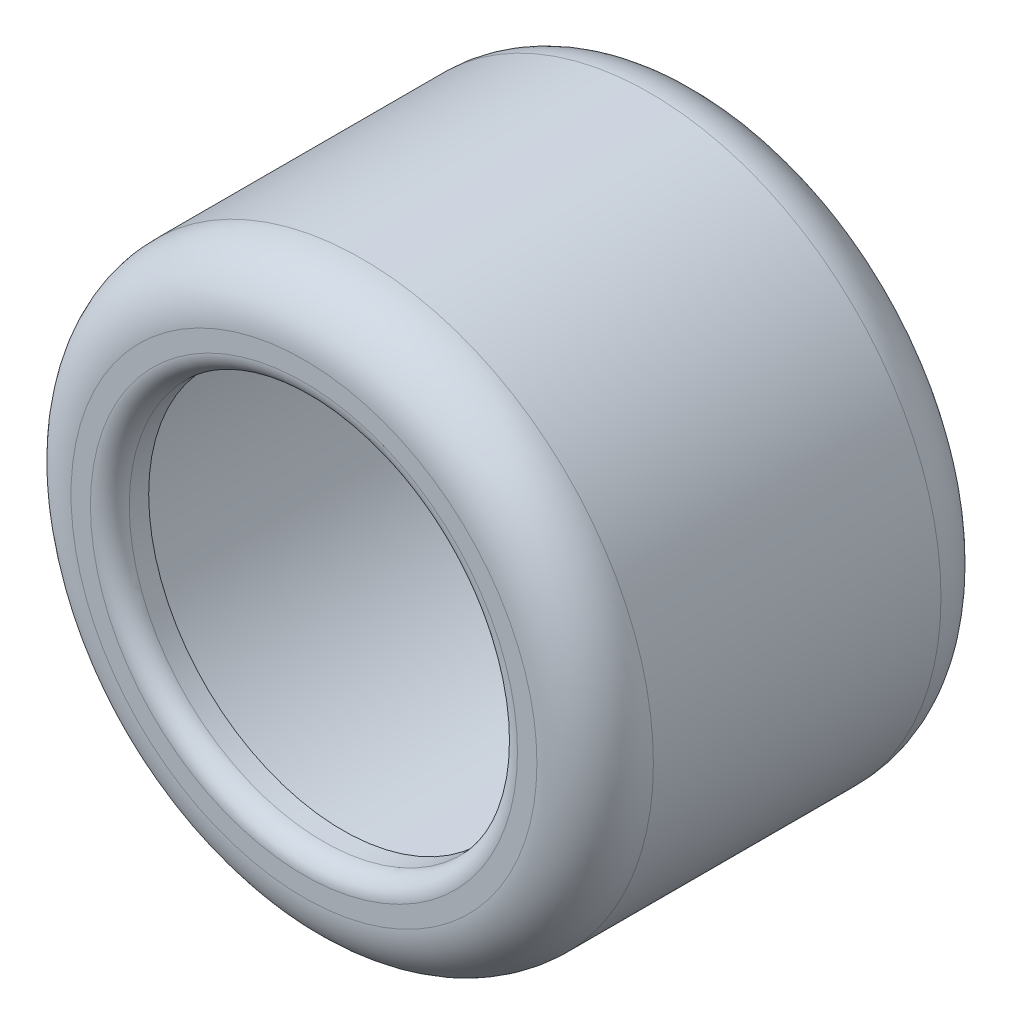
from build123d import *

# Parameters (mm, degrees)
CROQUIS1_R            = 15
CROQUIS1_R_2          = 10
EXTRUIR_L_MINA1_DEPTH = 20.815243217
REDONDEO1_R           = 3
REDONDEO2_R           = 1
ESCALA4_SCALE         = 4
ESCALA6_SCALE         = 2


# Read off the part's stored shape, not the designer's step: Vaciado1
with BuildPart() as part:
    # Croquis1 → Extruir-Lámina1 (new body)
    with BuildSketch(Plane.XY):
        Circle(CROQUIS1_R)
        Circle(CROQUIS1_R_2, mode=Mode.SUBTRACT)
    extrude(amount=EXTRUIR_L_MINA1_DEPTH)

    # Redondeo1
    redondeo1_edges = [part.edges().sort_by_distance(p)[0] for p in [
        (-15, 0, 0),
        (-15, 0, 20.815243217),
    ]]
    fillet(redondeo1_edges, radius=REDONDEO1_R)

    # Redondeo2
    redondeo2_edges = [part.edges().sort_by_distance(p)[0] for p in [
        (-10, 0, 0),
        (-10, 0, 20.815243217),
    ]]
    fillet(redondeo2_edges, radius=REDONDEO2_R)

    # Vaciado1 outline → Vaciado1 (revolve, cut)
    with BuildSketch(Plane.XZ):
        with BuildLine():
            Line((12, 18.815243217), (10, 18.815243217))
            Line((10, 18.815243217), (10, 2))
            Line((10, 2), (12, 2))
            ThreePointArc((12, 2), (12.707106781, 2.292893219), (13, 3))
            Line((13, 3), (13, 17.815243217))
            ThreePointArc((13, 17.815243217), (12.707106781, 18.522349998), (12, 18.815243217))
        make_face()
    revolve(axis=Axis((0, 0, 0), (0, 0, 1)), mode=Mode.SUBTRACT)


with BuildPart() as part_1:
    # Escala4: scaled about (0, 0, 10.407621608)
    add(part.part.scale(ESCALA4_SCALE).moved(Location((0, 0, -31.222864824))))


with BuildPart() as part_2:
    # Escala6: scaled about (0, 0, 10.407621608)
    add(part_1.part.scale(ESCALA6_SCALE).moved(Location((0, 0, -10.407621608))))


solid = part_2.part
